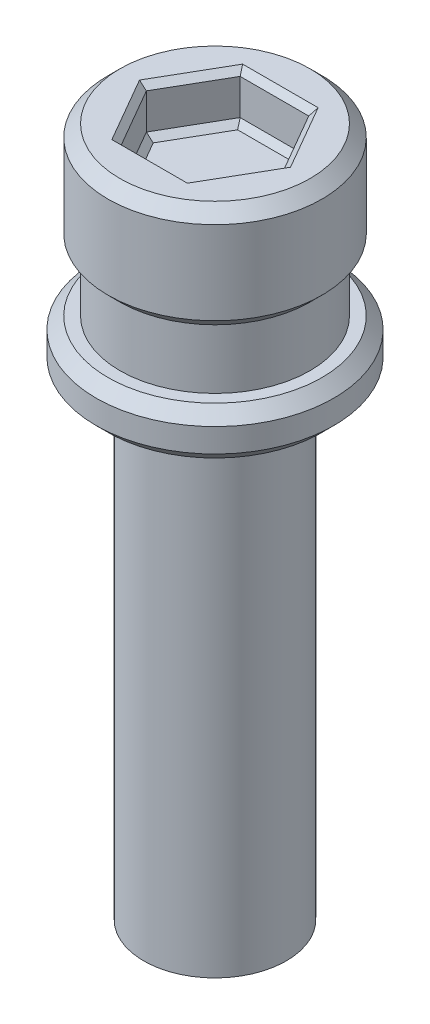
from build123d import *

# Parameters (mm, degrees)
SKETCH_1_R          = 4.5
EXTRUDE_1_DEPTH     = 4.5
CUT_EXTRUDE_1_DEPTH = 2
SKETCH_3_R          = 4
EXTRUDE_2_DEPTH     = 2.5
SKETCH_4_R          = 5
EXTRUDE_3_DEPTH     = 2
SKETCH_5_R          = 3
EXTRUDE_4_DEPTH     = 20
CHAMFER_1_SIZE      = 0.5
CHAMFER_2_SIZE      = 0.5
CHAMFER_3_SIZE      = 0.5
CHAMFER_4_SIZE      = 0.25


with BuildPart() as part:
    # ｽｹｯﾁ1 → ﾎﾞｽ - 押し出し1 (new body)
    with BuildSketch(Plane(origin=(0, 0, 0), x_dir=(1, 0, 0), z_dir=(0, 1, 0))):
        with Locations(Location((0, 0, 0), (0, 0, 270))):
            Circle(SKETCH_1_R)
    extrude(amount=EXTRUDE_1_DEPTH)

    # ｽｹｯﾁ2 → ｶｯﾄ - 押し出し1 (cut)
    with BuildSketch(Plane(origin=(0, 4.5, 0), x_dir=(1, 0, 0), z_dir=(0, 1, 0))):
        Polygon((2.886751346, 0), (1.443375673, 2.5), (-1.443375673, 2.5), (-2.886751346, 0), (-1.443375673, -2.5), (1.443375673, -2.5), align=None)
    extrude(amount=-CUT_EXTRUDE_1_DEPTH, mode=Mode.SUBTRACT)

    # ｽｹｯﾁ3 → ﾎﾞｽ - 押し出し2 (add)
    with BuildSketch(Plane.XZ):
        with Locations(Location((0, 0, 0), (0, 0, 90))):
            Circle(SKETCH_3_R)
    extrude(amount=EXTRUDE_2_DEPTH)

    # ｽｹｯﾁ4 → ﾎﾞｽ - 押し出し3 (add)
    with BuildSketch(Plane.XZ.offset(2.5)):
        with Locations(Location((0, 0, 0), (0, 0, 270))):
            Circle(SKETCH_4_R)
    extrude(amount=EXTRUDE_3_DEPTH)

    # ｽｹｯﾁ5 → ﾎﾞｽ - 押し出し4 (add)
    with BuildSketch(Plane.XZ.offset(4.5)):
        with Locations(Location((0, 0, 0), (0, 0, 270))):
            Circle(SKETCH_5_R)
    extrude(amount=EXTRUDE_4_DEPTH)

    # 面取り1
    chamfer_1_edges = [part.edges().sort_by_distance(p)[0] for p in [
        (0, 4.5, -4.5),
    ]]
    chamfer(chamfer_1_edges, length=CHAMFER_1_SIZE)

    # 面取り2
    chamfer_2_edges = [part.edges().sort_by_distance(p)[0] for p in [
        (0, 0, -4.5),
    ]]
    chamfer(chamfer_2_edges, length=CHAMFER_2_SIZE - 0.0001)  # a hair under: the kernel refuses the full size

    # 面取り3
    chamfer_3_edges = [part.edges().sort_by_distance(p)[0] for p in [
        (0, -2.5, 5),
        (0, -4.5, 5),
    ]]
    chamfer(chamfer_3_edges, length=CHAMFER_3_SIZE)

    # 面取り4
    chamfer_4_edges = [part.edges().sort_by_distance(p)[0] for p in [
        (2.165063509, 2.5, -1.25),
        (2.165063509, 4.5, 1.25),
        (2.165063509, 4.5, -1.25),
        (0, 4.5, -2.5),
        (-2.165063509, 4.5, -1.25),
        (-2.165063509, 4.5, 1.25),
        (0, 4.5, 2.5),
        (2.165063509, 2.5, 1.25),
        (0, 2.5, 2.5),
        (-2.165063509, 2.5, 1.25),
        (-2.165063509, 2.5, -1.25),
        (0, 2.5, -2.5),
    ]]
    chamfer(chamfer_4_edges, length=CHAMFER_4_SIZE)


solid = part.part
